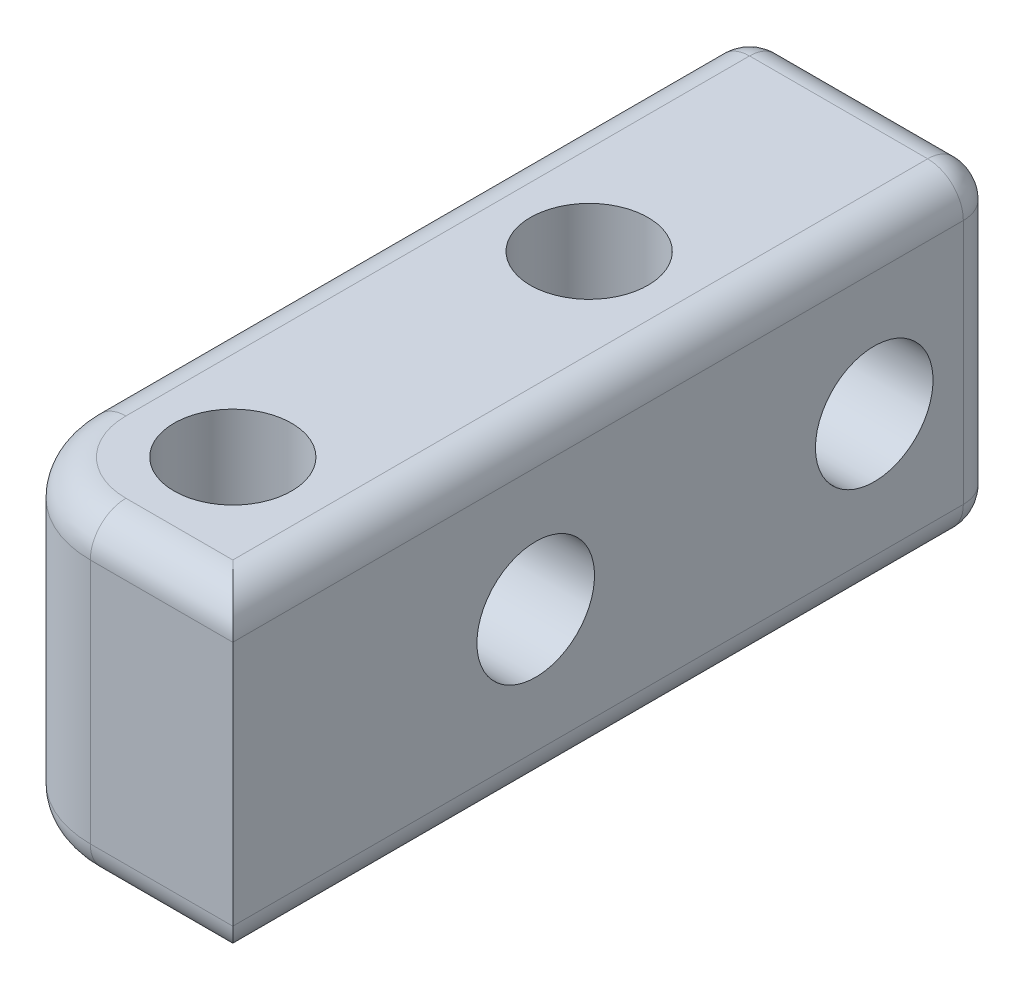
from build123d import *

# Parameters (mm, degrees)
SKETCH_1_W          = 7
SKETCH_1_H          = 8.9
EXTRUDE_1_DEPTH     = 21.5
FILLET_1_R          = 1
SKETCH_6_R          = 1.65
CUT_EXTRUDE_2_DEPTH = 10
SKETCH_7_R          = 1.65
CUT_EXTRUDE_3_DEPTH = 10
FILLET_3_R          = 3


with BuildPart() as part:
    # 草图1 → 凸台-拉伸1 (new body)
    with BuildSketch(Plane.XY):
        with Locations((3.5, 4.45)):
            Rectangle(SKETCH_1_W, SKETCH_1_H)
    extrude(amount=EXTRUDE_1_DEPTH)

    # 圆角1
    fillet_1_edges = [part.edges().sort_by_distance(p)[0] for p in [
        (3.5, 8.9, 21.5),
        (3.5, 8.9, 0),
        (7, 4.45, 0),
        (3.5, 0, 0),
        (0, 4.45, 0),
        (3.5, 0, 21.5),
        (0, 8.9, 10.75),
        (7, 8.9, 10.75),
        (7, 0, 10.75),
        (0, 0, 10.75),
    ]]
    fillet(fillet_1_edges, radius=FILLET_1_R)

    # 草图6 → 切除-拉伸2 (cut)
    with BuildSketch(Plane.ZY):
        with Locations((3.5, 4.45)):
            Circle(SKETCH_6_R)
        with Locations((13, 4.45)):
            Circle(SKETCH_6_R)
    extrude(amount=-CUT_EXTRUDE_2_DEPTH, mode=Mode.SUBTRACT)

    # 草图7 → 切除-拉伸3 (cut)
    with BuildSketch(Plane(origin=(0, 8.9, 0), x_dir=(1, 0, 0), z_dir=(0, 1, 0))):
        with Locations(Location((3.5, -8, 0), (0, 0, 270))):
            Circle(SKETCH_7_R)
        with Locations(Location((3.5, -18, 0), (0, 0, 270))):
            Circle(SKETCH_7_R)
    extrude(amount=-CUT_EXTRUDE_3_DEPTH, mode=Mode.SUBTRACT)

    # 圆角3
    # the kernel refuses this fillet: 3 mm, written as the material it takes off along each edge
    with BuildSketch(Plane(origin=(3, 0, 18.5), x_dir=(0, 0, 1), z_dir=(1, 0, 0))) as fillet_3_piece_1:
        with BuildLine():
            CenterArc((2, -1), 1, 0, 90)
            Line((3, -1), (3, 0))
            Line((3, 0), (2, 0))
        make_face()
    revolve(axis=Axis((3, 0, 18.5), (0, -1, 0)), revolution_arc=90, mode=Mode.SUBTRACT)
    with BuildSketch(Plane(origin=(3, 8.9, 18.5), x_dir=(-1, 0, 0), z_dir=(0, 0, -1))) as fillet_3_piece_2:
        with BuildLine():
            CenterArc((2, -1), 1, 0, 90)
            Line((3, -1), (3, 0))
            Line((3, 0), (2, 0))
        make_face()
    revolve(axis=Axis((3, 8.9, 18.5), (0, 1, 0)), revolution_arc=90, mode=Mode.SUBTRACT)
    with BuildSketch(Plane(origin=(0, 8.9, 21.5), x_dir=(0, 0, -1), z_dir=(0, -1, 0))) as fillet_3_piece_3:
        with BuildLine():
            CenterArc((FILLET_3_R, FILLET_3_R), FILLET_3_R, 180, 90)
            Line((0, FILLET_3_R), (0, 0))
            Line((0, 0), (FILLET_3_R, 0))
        make_face()
    extrude(amount=8.9, mode=Mode.SUBTRACT)


solid = part.part
